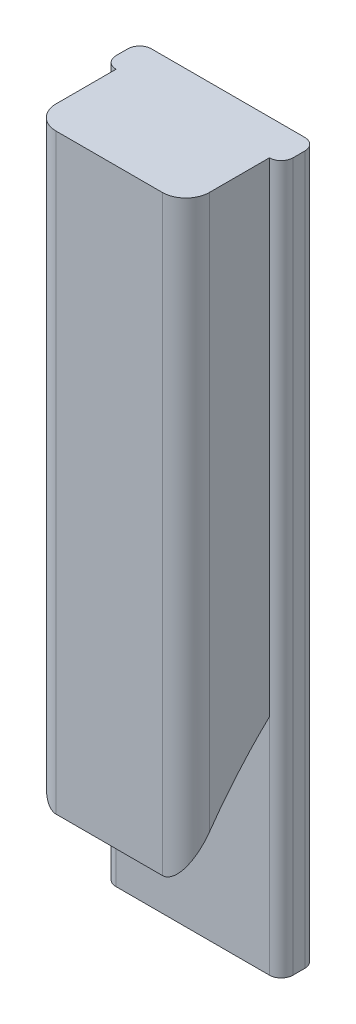
from build123d import *

# Parameters (mm, degrees)
SKETCH3_W              = 75
SKETCH3_H              = 300
BOSS_EXTRUDE1_DEPTH    = 15
SKETCH4_R              = 20
CUT_EXTRUDE1_DEPTH     = 5
FILLET1_R              = 5
BOSS_EXTRUDE4_DEPTH    = 65
FILLET3_R              = 10
FILLET4_R              = 10
SKETCH12_W             = 50
SKETCH12_H             = 20
BOSS_EXTRUDE5_DEPTH    = 4
FILLET5_R              = 10
LPATTERN3_COUNT        = 7
LPATTERN3_PITCH        = 25
FILLET5_OF_LPATTERN3_R = 10


with BuildPart() as part:
    # Sketch3 → Boss-Extrude1 (new body)
    with BuildSketch(Plane.XY):
        Rectangle(SKETCH3_W, SKETCH3_H)
    extrude(amount=BOSS_EXTRUDE1_DEPTH)

    # Sketch4 → Cut-Extrude1 (cut)
    with BuildSketch(Plane(origin=(0, 0, 0), x_dir=(-1, 0, 0), z_dir=(0, 0, -1))):
        with Locations((0, -120)):
            Circle(SKETCH4_R)
    extrude(amount=-CUT_EXTRUDE1_DEPTH, mode=Mode.SUBTRACT)

    # Fillet1
    fillet1_edges = [part.edges().sort_by_distance(p)[0] for p in [
        (37.5, 0, 15),
        (-37.5, 0, 15),
        (37.5, 0, 0),
        (-37.5, 0, 0),
    ]]
    fillet(fillet1_edges, radius=FILLET1_R)

    # Sketch11 → Boss-Extrude4 (add)
    with BuildSketch(Plane(origin=(32.5, 0, 0), x_dir=(0, 0, -1), z_dir=(1, 0, 0))):
        with BuildLine():
            Line((-15, 150), (-15, -55.184099518))
            add(Edge.make_bspline(
                [(-15, -55.184099518), (-36.150035241, -75.256670259), (-50.395734878, -100.703118223)],
                knots=[0, 0, 0, 1, 1, 1], degree=2))
            Line((-50.395734878, -100.703118223), (-50.395734878, 150))
            Line((-50.395734878, 150), (-15, 150))
        make_face()
    extrude(amount=-BOSS_EXTRUDE4_DEPTH)

    # Fillet3
    fillet3_edges = [part.edges().sort_by_distance(p)[0] for p in [
        (-32.5, 24.648440888, 50.395734878),
    ]]
    fillet(fillet3_edges, radius=FILLET3_R)

    # Fillet4
    fillet4_edges = [part.edges().sort_by_distance(p)[0] for p in [
        (32.5, 24.648440888, 50.395734878),
    ]]
    fillet(fillet4_edges, radius=FILLET4_R)

    # Sketch12 → Boss-Extrude5 (add)
    with BuildSketch(Plane(origin=(0, 0, 0), x_dir=(-1, 0, 0), z_dir=(0, 0, -1))):
        with Locations((-1.606045565, -56.843050926)):
            Rectangle(SKETCH12_W, SKETCH12_H)
    boss_extrude5 = extrude(amount=BOSS_EXTRUDE5_DEPTH)

    # Fillet5
    fillet5_edges = [part.edges().sort_by_distance(p)[0] for p in [
        (-23.393954435, -66.843050926, -2),
        (-23.393954435, -46.843050926, -2),
        (26.606045565, -66.843050926, -2),
        (26.606045565, -46.843050926, -2),
    ]]
    fillet(fillet5_edges, radius=FILLET5_R - 0.0001)  # a hair under: the kernel refuses the full size

    # LPattern3: Boss-Extrude5 ×7
    with Locations(*[(0, i * LPATTERN3_PITCH, 0) for i in range(1, LPATTERN3_COUNT)]):
        add(boss_extrude5)

    # Fillet5 of LPattern3
    fillet5_of_lpattern3_edges = [part.edges().sort_by_distance(p)[0] for p in [
        (-23.393954435, -41.843050926, -2),
        (-23.393954435, -21.843050926, -2),
        (26.606045565, -41.843050926, -2),
        (26.606045565, -21.843050926, -2),
        (-23.393954435, -16.843050926, -2),
        (-23.393954435, 3.156949074, -2),
        (26.606045565, -16.843050926, -2),
        (26.606045565, 3.156949074, -2),
        (-23.393954435, 8.156949074, -2),
        (-23.393954435, 28.156949074, -2),
        (26.606045565, 8.156949074, -2),
        (26.606045565, 28.156949074, -2),
        (-23.393954435, 33.156949074, -2),
        (-23.393954435, 53.156949074, -2),
        (26.606045565, 33.156949074, -2),
        (26.606045565, 53.156949074, -2),
        (-23.393954435, 58.156949074, -2),
        (-23.393954435, 78.156949074, -2),
        (26.606045565, 58.156949074, -2),
        (26.606045565, 78.156949074, -2),
        (-23.393954435, 83.156949074, -2),
        (-23.393954435, 103.156949074, -2),
        (26.606045565, 83.156949074, -2),
        (26.606045565, 103.156949074, -2),
    ]]
    fillet(fillet5_of_lpattern3_edges, radius=FILLET5_OF_LPATTERN3_R - 0.0001)  # a hair under: the kernel refuses the full size


solid = part.part
